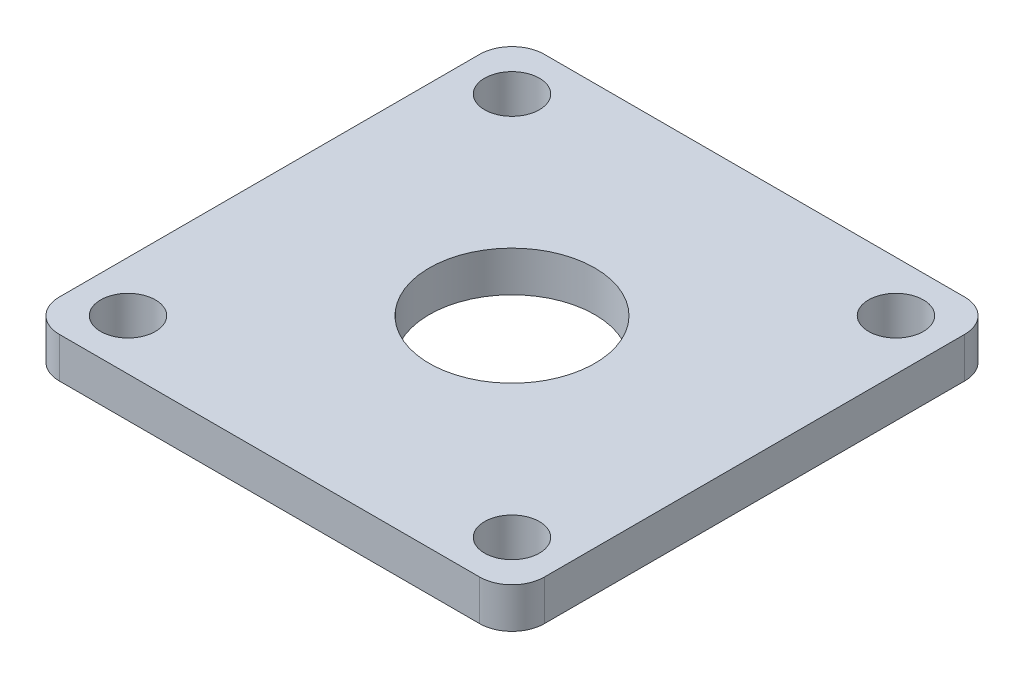
from build123d import *

# Parameters (mm, degrees)
SKETCH1_W           = 38.1
SKETCH1_H           = 38.1
SKETCH1_R           = 1.25
SKETCH1_R_2         = 1.5875
SKETCH1_R_3         = 4
BOSS_EXTRUDE1_DEPTH = 3.175
SKETCH4_R           = 1.7272
CUT_EXTRUDE2_DEPTH  = 10.795
SKETCH7_R           = 2.15265
CUT_EXTRUDE3_DEPTH  = 28.679008383
CIRPATTERN1_COUNT   = 4
SKETCH6_W           = 38.1
SKETCH6_H           = 38.1
SKETCH6_R           = 6.5
SKETCH6_R_2         = 2.15265
BOSS_EXTRUDE2_DEPTH = 3.175
FILLET1_R           = 2.54
FILLET2_R           = 2.54


with BuildPart() as part:
    # Sketch1 → Boss-Extrude1 (new, symmetric)
    with BuildSketch(Plane(origin=(0, 0, 0), x_dir=(1, 0, 0), z_dir=(0, 1, 0))):
        Rectangle(SKETCH1_W, SKETCH1_H)
        with Locations((0, -14.5)):
            Circle(SKETCH1_R, mode=Mode.SUBTRACT)
        with Locations((-8.838834765, -8.838834765)):
            Circle(SKETCH1_R_2, mode=Mode.SUBTRACT)
        with Locations((8.838834765, -8.838834765)):
            Circle(SKETCH1_R_2, mode=Mode.SUBTRACT)
        with Locations((-14.5, 0)):
            Circle(SKETCH1_R, mode=Mode.SUBTRACT)
        Circle(SKETCH1_R_3, mode=Mode.SUBTRACT)
        with Locations((-8.838834765, 8.838834765)):
            Circle(SKETCH1_R_2, mode=Mode.SUBTRACT)
        with Locations((0, 14.5)):
            Circle(SKETCH1_R, mode=Mode.SUBTRACT)
        with Locations((8.838834765, 8.838834765)):
            Circle(SKETCH1_R_2, mode=Mode.SUBTRACT)
        with Locations((14.5, 0)):
            Circle(SKETCH1_R, mode=Mode.SUBTRACT)
    extrude(amount=BOSS_EXTRUDE1_DEPTH, both=True)

    # Sketch4 → Cut-Extrude2 (cut)
    with BuildSketch(Plane.XY.offset(19.05)):
        with Locations((-5.55625, 0)):
            Circle(SKETCH4_R)
        with Locations((5.55625, 0)):
            Circle(SKETCH4_R)
    cut_extrude2 = extrude(amount=-CUT_EXTRUDE2_DEPTH, mode=Mode.SUBTRACT)

    # Sketch7 → Cut-Extrude3 (cut, through all)
    with BuildSketch(Plane.XZ.offset(3.175)):
        with Locations((-15.08125, 15.08125)):
            Circle(SKETCH7_R)
        with Locations((15.08125, 15.08125)):
            Circle(SKETCH7_R)
        with Locations((15.08125, -15.08125)):
            Circle(SKETCH7_R)
        with Locations((-15.08125, -15.08125)):
            Circle(SKETCH7_R)
    extrude(amount=-CUT_EXTRUDE3_DEPTH, mode=Mode.SUBTRACT)

    # CirPattern1: Cut-Extrude2 ×4 about axis
    cirpattern1_axis = Axis((0, 3.175, 0), (0, -1, 0))
    for i in range(1, CIRPATTERN1_COUNT):
        add(cut_extrude2.rotate(cirpattern1_axis, i * 360 / CIRPATTERN1_COUNT), mode=Mode.SUBTRACT)

    # Fillet1
    fillet1_edges = [part.edges().sort_by_distance(p)[0] for p in [
        (-19.05, 0, 19.05),
        (-19.05, 0, -19.05),
        (19.05, 0, -19.05),
        (19.05, 0, 19.05),
    ]]
    fillet(fillet1_edges, radius=FILLET1_R)


with BuildPart() as body_2:
    # Sketch6 → Boss-Extrude2 (new body)
    with BuildSketch(Plane(origin=(0, -32.512, 0), x_dir=(-1, 0, 0), z_dir=(0, -1, 0))):
        Rectangle(SKETCH6_W, SKETCH6_H)
        Circle(SKETCH6_R, mode=Mode.SUBTRACT)
        with Locations((-15.08125, 15.08125)):
            Circle(SKETCH6_R_2, mode=Mode.SUBTRACT)
        with Locations((15.08125, 15.08125)):
            Circle(SKETCH6_R_2, mode=Mode.SUBTRACT)
        with Locations((15.08125, -15.08125)):
            Circle(SKETCH6_R_2, mode=Mode.SUBTRACT)
        with Locations((-15.08125, -15.08125)):
            Circle(SKETCH6_R_2, mode=Mode.SUBTRACT)
    extrude(amount=BOSS_EXTRUDE2_DEPTH)

    # Fillet2
    fillet2_edges = [body_2.edges().sort_by_distance(p)[0] for p in [
        (-19.05, -34.0995, 19.05),
        (-19.05, -34.0995, -19.05),
        (19.05, -34.0995, -19.05),
        (19.05, -34.0995, 19.05),
    ]]
    fillet(fillet2_edges, radius=FILLET2_R)


solid = body_2.part
